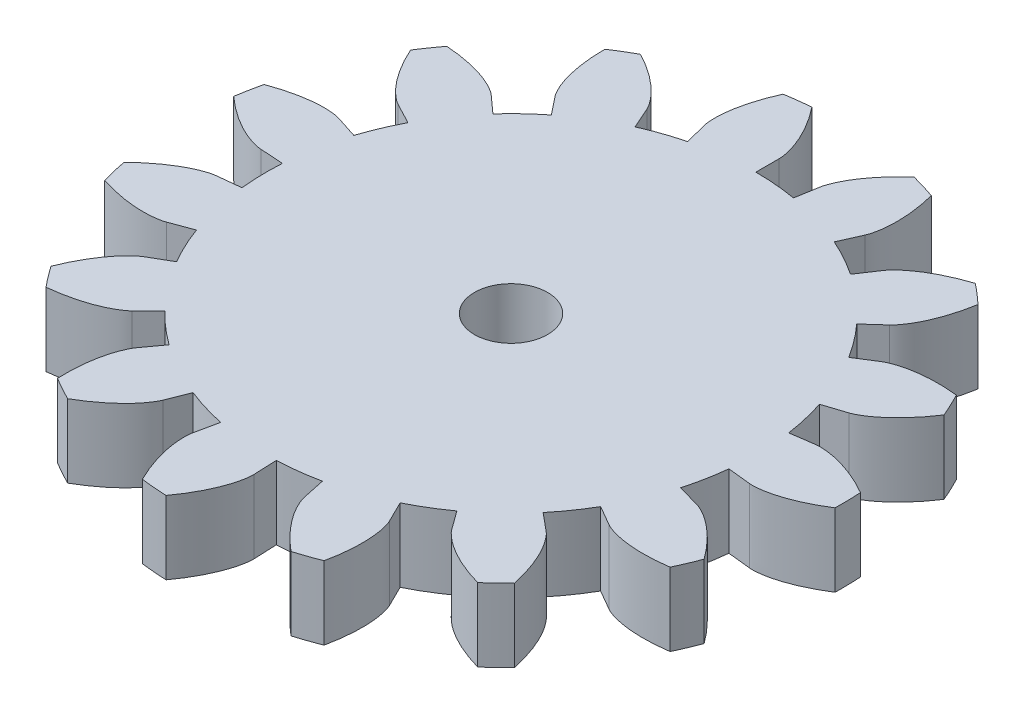
from build123d import *

# Parameters (mm, degrees)
GEAR_BILLET_R             = 13.5525
GEAR_BILLET_EXTRUDE_DEPTH = 3
CUT_TOOTH_PROFILE_REACH   = 21.399
DUPLICATE_TEETH_COUNT     = 15
SKETCH1_R                 = 1.5
CUT_EXTRUDE1_DEPTH        = 20.389822918


with BuildPart() as part:
    # Gear billet → Gear billet Extrude (new body)
    with BuildSketch(Plane(origin=(0, 0, 0), x_dir=(1, 0, 0), z_dir=(0, 1, 0))):
        Circle(GEAR_BILLET_R)
    extrude(amount=GEAR_BILLET_EXTRUDE_DEPTH)

    # Tooth profile → Cut tooth profile (cut, up to next)
    with BuildSketch(Plane(origin=(0, 3, 0), x_dir=(1, 0, 0), z_dir=(0, 1, 0)), mode=Mode.PRIVATE) as cut_tooth_profile_sk1:
        with BuildLine():
            Line((0, 10.994403663), (0, 10.0425))
            ThreePointArc((0, 10.0425), (0.847456117, 10.006678989), (1.68886658, 9.899471497))
            Line((1.68886658, 9.899471497), (1.848950054, 10.837817843))
            add(Edge.make_bspline(
                [(1.848950054, 10.837817843), (1.854654318, 10.871253999), (1.875059163, 10.964086076), (1.931487221, 11.136715155), (2.047260652, 11.408015433), (2.231545748, 11.743123569), (2.506193489, 12.15060416), (2.837154559, 12.552270491), (3.119999084, 12.844167157), (3.328551966, 13.038723365), (3.414061824, 13.115427485)],
                knots=[0, 0, 0, 0, 0, 0.005604071, 0.015718253, 0.029959921, 0.048733673, 0.068727069, 0.096888899, 0.115885683, 0.115885683, 0.115885683, 0.115885683, 0.115885683], degree=4))
            ThreePointArc((3.414061824, 13.115427485), (1.143654371, 13.504159023), (-1.159790944, 13.502782721))
            add(Edge.make_bspline(
                [(0, 10.994403663), (0, 11.028322907), (-0.004502483, 11.123264362), (-0.031095509, 11.302924418), (-0.099594968, 11.589830592), (-0.224899636, 11.95115759), (-0.427108958, 12.399022752), (-0.685807374, 12.850626783), (-0.915534712, 13.185932672), (-1.088398424, 13.412790688), (-1.159790944, 13.502782721)],
                knots=[0, 0, 0, 0, 0, 0.005604071, 0.015718253, 0.029959921, 0.048733673, 0.068727069, 0.096888899, 0.115885683, 0.115885683, 0.115885683, 0.115885683, 0.115885683], degree=4))
        make_face()
    cut_tooth_profile_tool1 = extrude(cut_tooth_profile_sk1.sketch, amount=-CUT_TOOTH_PROFILE_REACH, mode=Mode.PRIVATE) & part.part
    cut_tooth_profile = cut_tooth_profile_tool1.solids().sort_by_distance((1.020097, 3, -12.045209))[0]
    add(cut_tooth_profile, mode=Mode.SUBTRACT)

    # Duplicate teeth: Cut tooth profile ×15 about axis
    duplicate_teeth_axis = Axis((0, 3, 0), (0, -1, 0))
    for i in range(1, DUPLICATE_TEETH_COUNT):
        add(cut_tooth_profile.rotate(duplicate_teeth_axis, i * 360 / DUPLICATE_TEETH_COUNT), mode=Mode.SUBTRACT)

    # Sketch1 → Cut-Extrude1 (cut, through all)
    with BuildSketch(Plane(origin=(0, 3, 0), x_dir=(1, 0, 0), z_dir=(0, 1, 0))):
        Circle(SKETCH1_R)
    extrude(amount=-CUT_EXTRUDE1_DEPTH, mode=Mode.SUBTRACT)


solid = part.part
